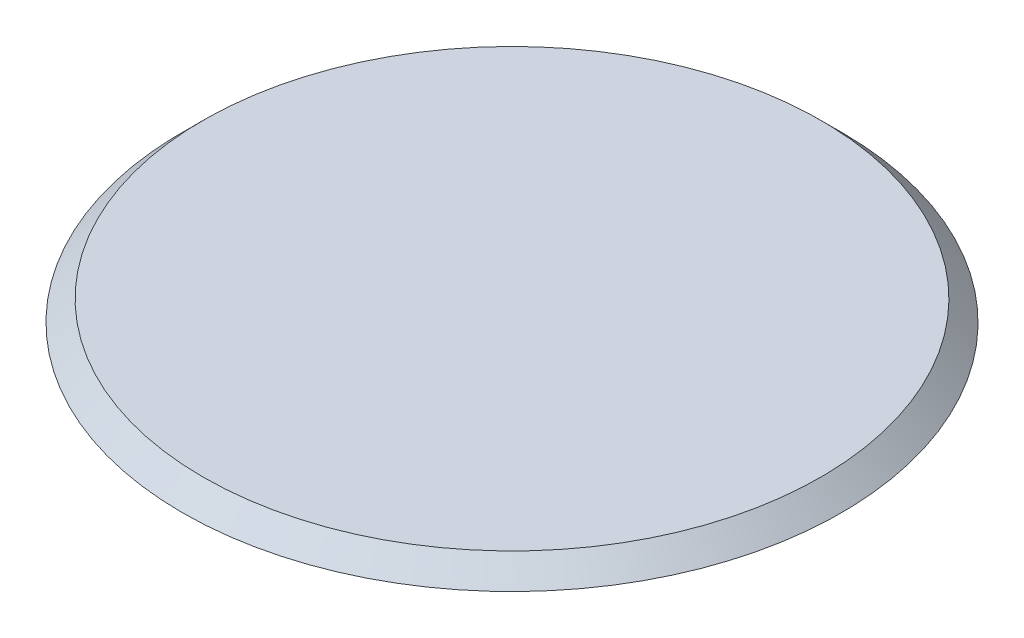
from build123d import *

# Parameters (mm, degrees)
FOOT_SHELL_T  = -0.5
FOOT_FILLET_R = 16


with BuildPart() as part:
    # Sketch1 → Foot Revolve (revolve)
    with BuildSketch(Plane.XY, mode=Mode.PRIVATE) as foot_revolve_sk:
        Polygon((0, 0), (16, 0), (15, 1), (0, 1), align=None)
    revolve(foot_revolve_sk.sketch.rotate(Axis((0, 1, 0), (0, -1, 0)), 90), axis=Axis((0, 1, 0), (0, -1, 0)))

    # Foot Shell
    foot_shell_openings = [part.faces().sort_by_distance(p)[0] for p in [
        (0, 0, 0),
    ]]
    offset(amount=FOOT_SHELL_T, openings=foot_shell_openings, kind=Kind.INTERSECTION)

    # Foot Fillet
    # the kernel refuses this fillet: 16 mm, written as the material it adds along each edge
    with BuildSketch(Plane(origin=(0, 0.5, 0), x_dir=(0, 0, 1), z_dir=(-1, 0, 0))) as foot_fillet_piece_1:
        with BuildLine():
            CenterArc((11.324266252, -16), FOOT_FILLET_R, 75.638488437, 14.361511563)
            Line((11.324266252, 0), (11.324266252, 0.32))
            Line((11.324266252, 0.32), (14.792893219, 0.32))
            Line((14.792893219, 0.32), (15.019167389, 0.22627417))
            ThreePointArc((15.019167389, 0.22627417), (15.269167389, -0.02372583), (15.372265758, -0.19))
            Line((15.372265758, -0.19), (15.292893219, -0.5))
        make_face()
    revolve(axis=Axis((0, 0.5, 0), (0, 1, 0)))


solid = part.part
